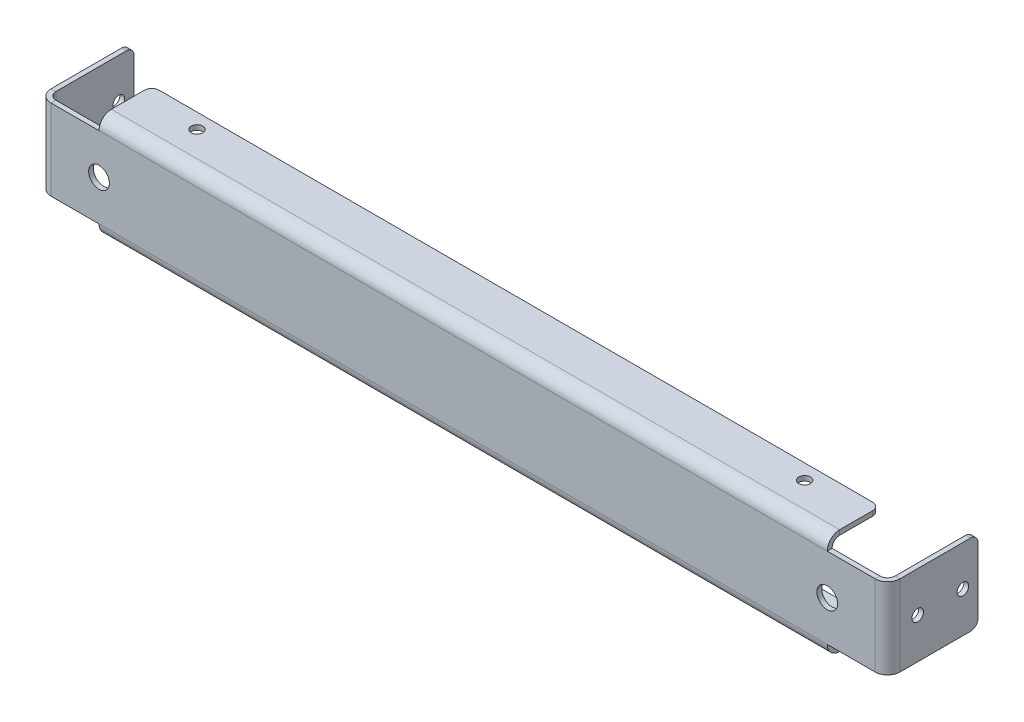
from build123d import *

# Parameters (mm, degrees)
BASE_FLANGE1_DEPTH           = 306.832
SKETCH2_W                    = 2.032
SKETCH2_H                    = 34.036
BOSS_EXTRUDE1_DEPTH          = 25.4
EDGE_FLANGE1_STRIP_W         = 14.478
EDGE_FLANGE1_STRIP_H         = 2.032
EDGE_FLANGE1_STRIP_CUT_DEPTH = 34.036
EDGE_FLANGE1_DEPTH           = 34.036
SKETCH6_R                    = 2.4511
CUT_EXTRUDE1_DEPTH           = 338.350728951
SKETCH7_R                    = 4.3688
CUT_EXTRUDE2_DEPTH           = 338.350728951
SKETCH8_R                    = 2.4511
CUT_EXTRUDE3_DEPTH           = 363.392135571
FILLET1_R                    = 3.175


# Sheet-metal steps are written as plain solids
with BuildPart() as part:
    # Sketch1 → Base-Flange1 (new body)
    with BuildSketch(Plane(origin=(0, 0, 0), x_dir=(0, 0, -1), z_dir=(1, 0, 0))):
        with BuildLine():
            Line((22.225, 0), (5.207, 0))
            ThreePointArc((5.207, 0), (1.52509499, 1.52509499), (0, 5.207))
            Line((0, 5.207), (0, 39.243))
            ThreePointArc((0, 39.243), (1.52509499, 42.92490501), (5.207, 44.45))
            Line((5.207, 44.45), (22.225, 44.45))
            Line((22.225, 44.45), (22.225, 42.418))
            Line((22.225, 42.418), (5.207, 42.418))
            ThreePointArc((5.207, 42.418), (2.96193597, 41.48806403), (2.032, 39.243))
            Line((2.032, 39.243), (2.032, 5.207))
            ThreePointArc((2.032, 5.207), (2.96193597, 2.96193597), (5.207, 2.032))
            Line((5.207, 2.032), (22.225, 2.032))
            Line((22.225, 2.032), (22.225, 0))
        make_face()
    extrude(amount=BASE_FLANGE1_DEPTH)

    # Sketch2 → Boss-Extrude1 (add)
    with BuildSketch(Plane(origin=(306.832, 0, 0), x_dir=(0, 0, -1), z_dir=(1, 0, 0))):
        with Locations((1.016, 22.225)):
            Rectangle(SKETCH2_W, SKETCH2_H)
    boss_extrude1 = extrude(amount=BOSS_EXTRUDE1_DEPTH)

    # Edge-Flange1 strip (across the edge) → Edge-Flange1 strip cut (cut)
    with BuildSketch(Plane(origin=(332.232, 39.243, -2.032), x_dir=(-1, 0, 0), z_dir=(0, -1, 0))):
        with Locations((-2.032, -1.016)):
            Rectangle(EDGE_FLANGE1_STRIP_W, EDGE_FLANGE1_STRIP_H)
    edge_flange1_strip_cut = extrude(amount=EDGE_FLANGE1_STRIP_CUT_DEPTH, mode=Mode.SUBTRACT)

    # Edge-Flange1 section (across the edge) → Edge-Flange1 (add)
    with BuildSketch(Plane(origin=(332.232, 39.243, -2.032), x_dir=(-1, 0, 0), z_dir=(0, -1, 0))):
        with BuildLine():
            Line((0, 3.175), (0, 36.068))
            Line((0, 36.068), (2.032, 36.068))
            Line((2.032, 36.068), (2.032, 3.175))
            ThreePointArc((2.032, 3.175), (2.96193597, 0.92993597), (5.207, 0))
            Line((5.207, 0), (5.207, -2.032))
            ThreePointArc((5.207, -2.032), (1.52509499, -0.50690501), (0, 3.175))
        make_face()
    edge_flange1 = extrude(amount=EDGE_FLANGE1_DEPTH)

    # Mirror1: Boss-Extrude1, Edge-Flange1 strip cut, Edge-Flange1 across plane
    add(boss_extrude1.mirror(Plane.ZY.offset(-153.416)))
    add(edge_flange1_strip_cut.mirror(Plane.ZY.offset(-153.416)), mode=Mode.SUBTRACT)
    add(edge_flange1.mirror(Plane.ZY.offset(-153.416)))

    # Sketch6 → Cut-Extrude1 (cut, through all)
    with BuildSketch(Plane(origin=(0, 44.45, 0), x_dir=(1, 0, 0), z_dir=(0, 1, 0))):
        with Locations(Location((25.4, 15.875, 0), (0, 0, 270))):
            Circle(SKETCH6_R)
        with Locations(Location((281.432, 15.875, 0), (0, 0, 270))):
            Circle(SKETCH6_R)
    extrude(amount=-CUT_EXTRUDE1_DEPTH, mode=Mode.SUBTRACT)

    # Sketch7 → Cut-Extrude2 (cut, through all)
    with BuildSketch(Plane.XY):
        with Locations((0, 22.225)):
            Circle(SKETCH7_R)
        with Locations((306.832, 22.225)):
            Circle(SKETCH7_R)
    extrude(amount=-CUT_EXTRUDE2_DEPTH, mode=Mode.SUBTRACT)

    # Sketch8 → Cut-Extrude3 (cut, through all)
    with BuildSketch(Plane(origin=(332.232, 0, 0), x_dir=(0, 0, -1), z_dir=(1, 0, 0))):
        with Locations((31.75, 22.225)):
            Circle(SKETCH8_R)
        with Locations((12.7, 22.225)):
            Circle(SKETCH8_R)
    extrude(amount=-CUT_EXTRUDE3_DEPTH, mode=Mode.SUBTRACT)

    # Fillet1
    fillet1_edges = [part.edges().sort_by_distance(p)[0] for p in [
        (-24.384, 5.207, -38.1),
        (0, 1.016, -22.225),
        (-24.384, 39.243, -38.1),
        (0, 43.434, -22.225),
        (306.832, 1.016, -22.225),
        (331.216, 39.243, -38.1),
        (331.216, 5.207, -38.1),
        (306.832, 43.434, -22.225),
    ]]
    fillet(fillet1_edges, radius=FILLET1_R)


solid = part.part
